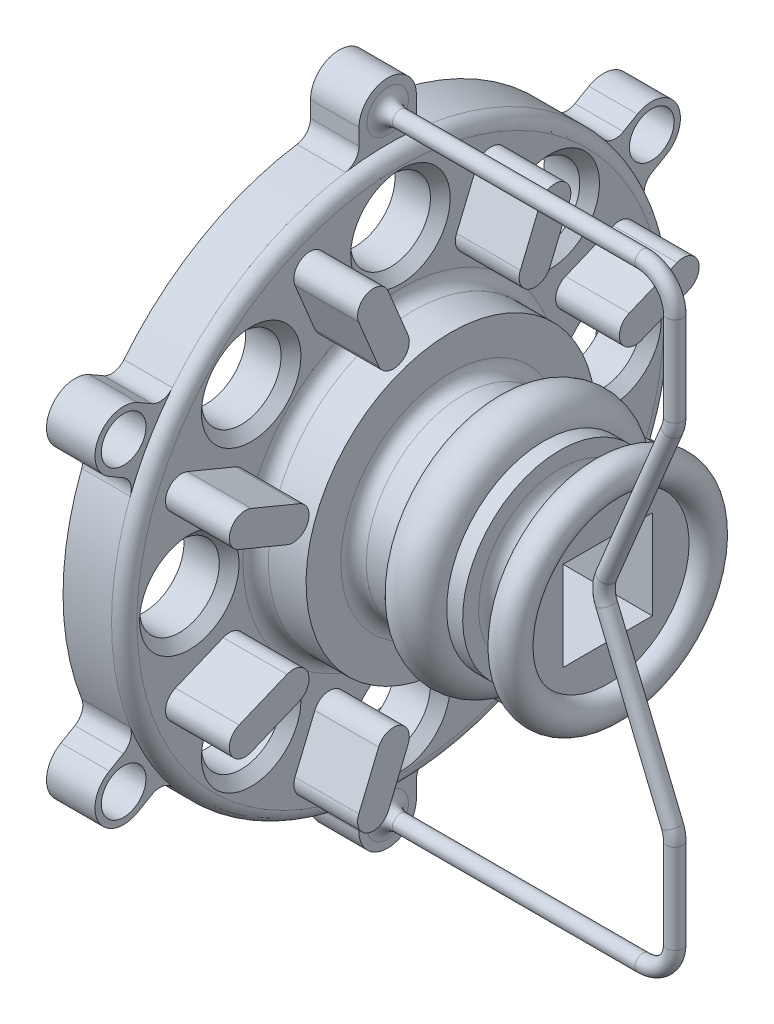
from build123d import *

# Parameters (mm, degrees)
CUT_EXTRUDE2_REACH           = 59.476
SKETCH2_W                    = 17.78
SKETCH2_H                    = 17.78
BOSS_EXTRUDE1_START          = 12.192
SKETCH3_R                    = 54.991
SKETCH3_R_2                  = 24.511
BOSS_EXTRUDE1_DEPTH          = 12.192
SKETCH5_R                    = 51.816
CUT_EXTRUDE4_DEPTH           = 3.175
CHAMFER1_SIZE                = 6.35
CUT_EXTRUDE3_REACH           = 91.576
SKETCH4_R                    = 7.9375
BOSS_EXTRUDE2_DEPTH          = 12.7
CHAMFER2_SIZE                = 1.9685
CIRPATTERN1_COUNT            = 8
CHAMFER2_OF_CIRPATTERN1_SIZE = 1.9685
BOSS_EXTRUDE3_DEPTH          = 9.652
FILLET1_R                    = 3.175
CIRPATTERN2_COUNT            = 6
FILLET1_OF_CIRPATTERN2_R     = 3.175
SKETCH8_R                    = 4.445
CUT_EXTRUDE5_DEPTH           = 9.652
SKETCH10_R                   = 1.5875
FILLET2_R                    = 2.54


with BuildPart() as part:
    # Sketch1 → Revolve1 (revolve)
    with BuildSketch(Plane.XY):
        with BuildLine():
            Line((0, 24.511), (0, 28.829))
            Line((0, 28.829), (10.033, 28.829))
            Line((10.033, 28.829), (10.033, 19.3675))
            Line((10.033, 19.3675), (18.415, 19.3675))
            ThreePointArc((18.415, 19.3675), (23.495, 24.4475), (28.575, 19.3675))
            Line((28.575, 19.3675), (31.75, 19.3675))
            Line((31.75, 19.3675), (31.75, 16.1925))
            ThreePointArc((31.75, 16.1925), (34.925, 13.0175), (38.1, 16.1925))
            Line((38.1, 16.1925), (38.1, 19.3675))
            ThreePointArc((38.1, 19.3675), (43.52006403, 21.61256403), (41.275, 16.1925))
            Line((41.275, 16.1925), (41.275, 0))
            Line((41.275, 0), (3.937, 0))
            Line((3.937, 0), (3.937, 24.511))
            Line((3.937, 24.511), (0, 24.511))
        make_face()
    revolve(axis=Axis((41.275, 0, 0), (-1, 0, 0)))

    # Sketch2 → Cut-Extrude2 (cut, up to next)
    with BuildSketch(Plane.ZY.offset(-3.937), mode=Mode.PRIVATE) as cut_extrude2_sk1:
        Rectangle(SKETCH2_W, SKETCH2_H)
    cut_extrude2_tool1 = extrude(cut_extrude2_sk1.sketch, amount=-CUT_EXTRUDE2_REACH, mode=Mode.PRIVATE) & part.part
    add(cut_extrude2_tool1.solids().sort_by_distance((3.937, 0, 0))[0], mode=Mode.SUBTRACT)

    # Sketch3 → Boss-Extrude1 (add)
    with BuildSketch(Plane.ZY.offset(BOSS_EXTRUDE1_START)):
        with Locations(Location((0, 0, 0), (0, 0, 90))):
            Circle(SKETCH3_R)
        with Locations(Location((0, 0, 0), (0, 0, 90))):
            Circle(SKETCH3_R_2, mode=Mode.SUBTRACT)
    extrude(amount=-BOSS_EXTRUDE1_DEPTH)

    # Sketch5 → Cut-Extrude4 (cut)
    with BuildSketch(Plane.ZY.offset(12.192)):
        with Locations(Location((0, 0, 0), (0, 0, 270))):
            Circle(SKETCH5_R)
    extrude(amount=-CUT_EXTRUDE4_DEPTH, mode=Mode.SUBTRACT)

    # Chamfer1
    chamfer1_edges = [part.edges().sort_by_distance(p)[0] for p in [
        (-9.017, -24.511, 0),
    ]]
    chamfer(chamfer1_edges, length=CHAMFER1_SIZE)

    # Sketch4 → Cut-Extrude3 (cut, up to next)
    with BuildSketch(Plane(origin=(0, 0, 0), x_dir=(0, 0, -1), z_dir=(1, 0, 0)), mode=Mode.PRIVATE) as cut_extrude3_sk1:
        with Locations(Location((29.724647761, 29.724647761, 0), (0, 0, 90))):
            Circle(SKETCH4_R)
    cut_extrude3_tool1 = extrude(cut_extrude3_sk1.sketch, amount=-CUT_EXTRUDE3_REACH, mode=Mode.PRIVATE) & part.part
    cut_extrude3 = cut_extrude3_tool1.solids().sort_by_distance((0, 29.724648, -29.724648))[0]
    add(cut_extrude3, mode=Mode.SUBTRACT)

    # Sketch6 → Boss-Extrude2 (add)
    with BuildSketch(Plane(origin=(0, 0, 0), x_dir=(0, 0, -1), z_dir=(1, 0, 0))):
        with BuildLine():
            Line((32.858396365, 17.046988648), (42.385811656, 20.993373276))
            ThreePointArc((42.385811656, 20.993373276), (46.534149069, 19.275075658), (44.815851451, 15.126738245))
            Line((44.815851451, 15.126738245), (35.28843616, 11.180353617))
            ThreePointArc((35.28843616, 11.180353617), (31.140098747, 12.898651235), (32.858396365, 17.046988648))
        make_face()
    boss_extrude2 = extrude(amount=BOSS_EXTRUDE2_DEPTH)

    # Chamfer2
    chamfer2_edges = [part.edges().sort_by_distance(p)[0] for p in [
        (0, 21.787147761, -29.724647761),
    ]]
    chamfer(chamfer2_edges, length=CHAMFER2_SIZE)

    # CirPattern1: Cut-Extrude3, Boss-Extrude2 ×8 about axis
    cirpattern1_axis = Axis((0, 0, 0), (1, 0, 0))
    add([cut_extrude3.rotate(cirpattern1_axis, i * 360 / CIRPATTERN1_COUNT) for i in range(1, CIRPATTERN1_COUNT)], mode=Mode.SUBTRACT)
    add([boss_extrude2.rotate(cirpattern1_axis, i * 360 / CIRPATTERN1_COUNT) for i in range(1, CIRPATTERN1_COUNT)])

    # Chamfer2 of CirPattern1
    chamfer2_of_cirpattern1_edges = [part.edges().sort_by_distance(p)[0] for p in [
        (0, 36.424339924, -5.612660076),
        (0, 29.724647761, 21.787147761),
        (0, 5.612660076, 36.424339924),
        (0, -21.787147761, 29.724647761),
        (0, -36.424339924, 5.612660076),
        (0, -29.724647761, -21.787147761),
        (0, -5.612660076, -36.424339924),
    ]]
    chamfer(chamfer2_of_cirpattern1_edges, length=CHAMFER2_OF_CIRPATTERN1_SIZE)

    # Sketch7 → Boss-Extrude3 (add)
    with BuildSketch(Plane.ZY.offset(12.192)):
        with BuildLine():
            Line((5.715, 60.706), (5.715, 54.693224955))
            ThreePointArc((5.715, 54.693224955), (0, 54.991), (-5.715, 54.693224955))
            Line((-5.715, 54.693224955), (-5.715, 60.706))
            ThreePointArc((-5.715, 60.706), (0, 66.421), (5.715, 60.706))
        make_face()
    boss_extrude3 = extrude(amount=-BOSS_EXTRUDE3_DEPTH)

    # Fillet1
    fillet1_edges = [part.edges().sort_by_distance(p)[0] for p in [
        (-7.366, 54.693224955, 5.715),
        (-7.366, 54.693224955, -5.715),
    ]]
    fillet(fillet1_edges, radius=FILLET1_R)

    # CirPattern2: Boss-Extrude3 ×6 about axis
    cirpattern2_axis = Axis((0, 0, 0), (1, 0, 0))
    for i in range(1, CIRPATTERN2_COUNT):
        add(boss_extrude3.rotate(cirpattern2_axis, i * 360 / CIRPATTERN2_COUNT))

    # Fillet1 of CirPattern2
    fillet1_of_cirpattern2_edges = [part.edges().sort_by_distance(p)[0] for p in [
        (-7.366, 22.397277295, 50.223222226),
        (-7.366, 32.29594766, 44.508222226),
        (-7.366, -32.29594766, 44.508222226),
        (-7.366, -22.397277295, 50.223222226),
        (-7.366, -54.693224955, -5.715),
        (-7.366, -54.693224955, 5.715),
        (-7.366, -22.397277295, -50.223222226),
        (-7.366, -32.29594766, -44.508222226),
        (-7.366, 32.29594766, -44.508222226),
        (-7.366, 22.397277295, -50.223222226),
    ]]
    fillet(fillet1_of_cirpattern2_edges, radius=FILLET1_OF_CIRPATTERN2_R)

    # Sketch8 → Cut-Extrude5 (cut)
    with BuildSketch(Plane.ZY.offset(12.192)):
        with Locations(Location((52.572938162, 30.353, 0), (0, 0, 270))):
            Circle(SKETCH8_R)
        with Locations(Location((52.572938162, -30.353, 0), (0, 0, 270))):
            Circle(SKETCH8_R)
        with Locations(Location((-52.572938162, -30.353, 0), (0, 0, 270))):
            Circle(SKETCH8_R)
        with Locations(Location((-52.572938162, 30.353, 0), (0, 0, 270))):
            Circle(SKETCH8_R)
    extrude(amount=-CUT_EXTRUDE5_DEPTH, mode=Mode.SUBTRACT)

    # Sweep1: sweep along a path in Sketch9
    with BuildLine(Plane.XY) as sweep1_path:
        Line((-2.54, 60.706), (48.26, 60.706))
        ThreePointArc((48.26, 60.706), (52.750128061, 58.846128061), (54.61, 54.356))
        Line((54.61, 54.356), (54.61, 36.567559318))
        ThreePointArc((54.61, 36.567559318), (54.488274294, 35.330183338), (54.127763995, 34.140246875))
        Line((54.127763995, 34.140246875), (41.009104069, 2.427312444))
        ThreePointArc((41.009104069, 2.427312444), (40.526868063, 0), (41.009104069, -2.427312444))
        Line((41.009104069, -2.427312444), (54.127763995, -34.140246875))
        ThreePointArc((54.127763995, -34.140246875), (54.488274294, -35.330183338), (54.61, -36.567559318))
        Line((54.61, -36.567559318), (54.61, -54.356))
        ThreePointArc((54.61, -54.356), (52.750128061, -58.846128061), (48.26, -60.706))
        Line((48.26, -60.706), (-2.54, -60.706))
    # Sketch10 → Sweep1 (sweep)
    with BuildSketch(Plane(origin=(-2.54, 0, 0), x_dir=(0, 0, -1), z_dir=(1, 0, 0))):
        with Locations((0, 60.706)):
            Circle(SKETCH10_R)
    sweep(path=sweep1_path.line)

    # Fillet2
    fillet2_edges = [part.edges().sort_by_distance(p)[0] for p in [
        (3.937, -24.511, 0),
        (10.033, -19.3675, 0),
        (0, -28.829, 0),
        (0, -54.991, 0),
        (-2.54, -60.706, 1.5875),
        (-2.54, 60.706, 1.5875),
    ]]
    fillet(fillet2_edges, radius=FILLET2_R - 0.0001)  # a hair under: the kernel refuses the full size


solid = part.part
